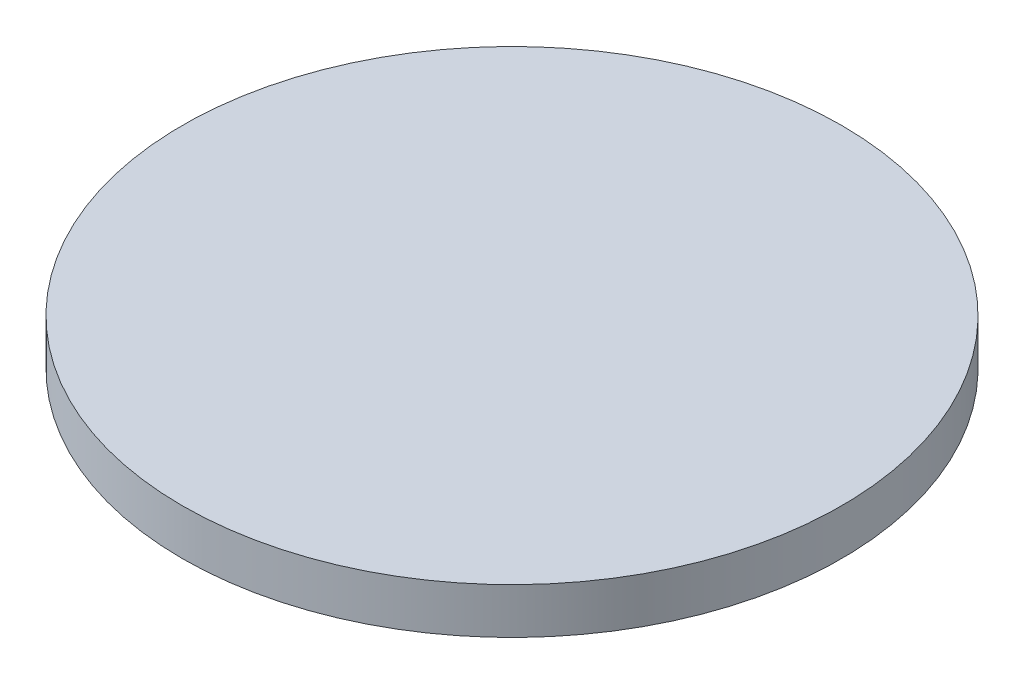
from build123d import *

# Parameters (mm, degrees)
SKETCH1_R                = 18
BOSS_EXTRUDE1_DEPTH      = 2.5
CUT_EXTRUDE4_OUTLINE_W   = 10.16
CUT_EXTRUDE4_OUTLINE_H   = 5.715
CUT_EXTRUDE4_OUTLINE_W_2 = 2.312550402
CUT_EXTRUDE4_OUTLINE_H_2 = 3.94124845
CUT_EXTRUDE4_OUTLINE_W_3 = 2.75
CUT_EXTRUDE4_OUTLINE_H_3 = 3.7
CUT_EXTRUDE4_OUTLINE_W_4 = 9.525
CUT_EXTRUDE4_OUTLINE_H_4 = 5.6
CUT_EXTRUDE4_DEPTH       = 2


# Read off the part's stored shape, not the designer's step: Cut-Extrude4
with BuildPart() as part:
    # Sketch1 → Boss-Extrude1 (new body)
    with BuildSketch(Plane(origin=(0, 0, 0), x_dir=(1, 0, 0), z_dir=(0, 1, 0))):
        with Locations(Location((0, 0, 0), (0, 0, 270))):
            Circle(SKETCH1_R)
    extrude(amount=BOSS_EXTRUDE1_DEPTH)

    # Cut-Extrude4 outline → Cut-Extrude4 (cut)
    with BuildSketch(Plane(origin=(0, 0, 0), x_dir=(1, 0, 0), z_dir=(0, 1, 0))):
        with Locations((0, -6.35)):
            Rectangle(CUT_EXTRUDE4_OUTLINE_W, CUT_EXTRUDE4_OUTLINE_H)
        with Locations((6.578724799, 4.629375775)):
            Rectangle(CUT_EXTRUDE4_OUTLINE_W_2, CUT_EXTRUDE4_OUTLINE_H_2)
        with Locations((6.36, 0)):
            Rectangle(CUT_EXTRUDE4_OUTLINE_W_3, CUT_EXTRUDE4_OUTLINE_H_3)
        Polygon((-4.297709584, -13.968636918), (-2.881780884, -10.550282647), (-5.422449598, -9.497903208), (-6.838378298, -12.916257479), align=None)
        Polygon((2.881780884, 10.550282647), (5.422449598, 9.497903208), (6.838378298, 12.916257479), (4.297709584, 13.968636918), align=None)
        Polygon((-0.535919412, -14.604996247), (-0.052972501, -10.93665026), (-2.77944587, -10.577703232), (-3.262392781, -14.246049219), align=None)
        Polygon((0.052972501, 10.93665026), (2.77944587, 10.577703232), (3.262392781, 14.246049219), (0.535919412, 14.604996247), align=None)
        Polygon((-10.706244136, -9.948339635), (-7.770836777, -7.695922348), (-9.444930707, -5.514200662), (-12.380338066, -7.766617949), align=None)
        Polygon((-7.766617949, -12.380338066), (-5.514200662, -9.444930707), (-7.695922348, -7.770836777), (-9.948339635, -10.706244136), align=None)
        with Locations((-3.175, 0)):
            Rectangle(CUT_EXTRUDE4_OUTLINE_W_3, CUT_EXTRUDE4_OUTLINE_H_3)
        with Locations((-6.35, 0)):
            Rectangle(CUT_EXTRUDE4_OUTLINE_W_3, CUT_EXTRUDE4_OUTLINE_H_3)
        with Locations((-9.525, 0)):
            Rectangle(CUT_EXTRUDE4_OUTLINE_W_3, CUT_EXTRUDE4_OUTLINE_H_3)
        Rectangle(CUT_EXTRUDE4_OUTLINE_W_3, CUT_EXTRUDE4_OUTLINE_H_3)
        with Locations((3.18, 0)):
            Rectangle(CUT_EXTRUDE4_OUTLINE_W_3, CUT_EXTRUDE4_OUTLINE_H_3)
        with Locations((9.54, 0)):
            Rectangle(CUT_EXTRUDE4_OUTLINE_W_3, CUT_EXTRUDE4_OUTLINE_H_3)
        with Locations((0, 6.6)):
            Rectangle(CUT_EXTRUDE4_OUTLINE_W_4, CUT_EXTRUDE4_OUTLINE_H_4)
        Polygon((-6.838378298, 12.916257479), (-5.422449598, 9.497903208), (-2.881780884, 10.550282647), (-4.297709584, 13.968636918), align=None)
        Polygon((5.422449598, -9.497903208), (2.881780884, -10.550282647), (4.297709584, -13.968636918), (6.838378298, -12.916257479), align=None)
        Polygon((-3.262392781, 14.246049219), (-2.77944587, 10.577703232), (-0.052972501, 10.93665026), (-0.535919412, 14.604996247), align=None)
        Polygon((2.77944587, -10.577703232), (0.052972501, -10.93665026), (0.535919412, -14.604996247), (3.262392781, -14.246049219), align=None)
        Polygon((12.380338066, -7.766617949), (9.444930707, -5.514200662), (7.770836777, -7.695922348), (10.706244136, -9.948339635), align=None)
        Polygon((9.948339635, -10.706244136), (7.695922348, -7.770836777), (5.514200662, -9.444930707), (7.766617949, -12.380338066), align=None)
    extrude(amount=CUT_EXTRUDE4_DEPTH, mode=Mode.SUBTRACT)


solid = part.part
